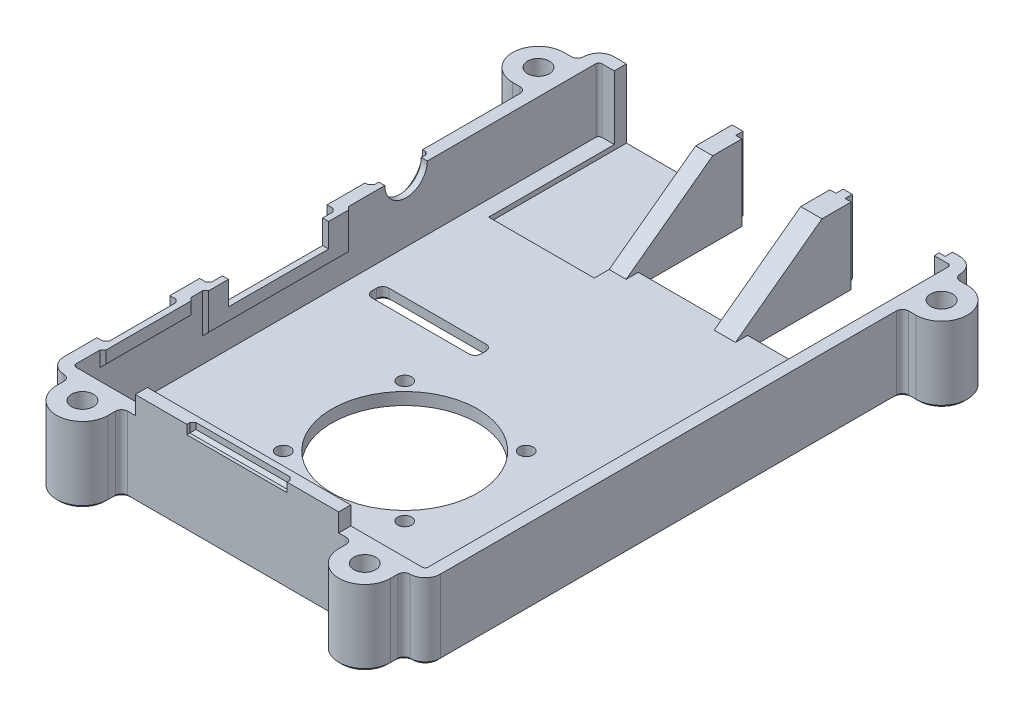
from build123d import *

# Parameters (mm, degrees)
BASE_DEPTH                      = 12.5
SHELL_T                         = -2
CLAMPS_DEPTH                    = 12.5
CLAMP_FILLETS_R                 = 1
SKETCH20_R                      = 1.8
CLAMP_HOLES_DEPTH               = 115.236651299
SKETCH21_R                      = 2.9
CLAMP_COUNTERSINKS_DEPTH        = 3.4
CLAMP_COUNTERSINK_CHAMFERS_SIZE = 0.3
SKETCH22_W                      = 33.5
SKETCH22_H                      = 2
SD_FILL_DEPTH                   = 3
SKETCH23_W                      = 16.5
SKETCH23_H                      = 1.5
SD_APPROACH_DEPTH               = 1
SD_APPROACH_CHAMFER_SIZE        = 0.5
SKETCH24_W                      = 14.5
SKETCH24_H                      = 12.5
USB_CUTOUT_DEPTH                = 18.25
SKETCH25_W                      = 16.5
SKETCH25_H                      = 12.5
USB_APPROACH_DEPTH              = 1.2
USB_INNER_SUPPORT_DEPTH         = 3.5
USB_OUTER_SUPPORT_DEPTH         = 2.8
SKETCH28_W                      = 17.4
SKETCH28_H                      = 11.3
RJ45_CUTOUT_DEPTH               = 22.7
SKETCH29_W                      = 15
SKETCH29_H                      = 2.5
SKETCH29_W_2                    = 24
SKETCH29_H_2                    = 6.43
HDMI_SUPPORT_DEPTH              = 0.5
HDMI_SUPPORT_CHAMFER_SIZE       = 0.5
SKETCH30_W                      = 21
SKETCH30_H                      = 5.93
SKETCH30_W_2                    = 12
SKETCH30_H_2                    = 2
HDMI_APPROACH_DEPTH             = 1.5
SKETCH31_W                      = 16.5
SKETCH31_H                      = 3.93
HDMI_CUTOUT_DEPTH               = 1
HDMI_APPROACH_CHAMFER_SIZE      = 0.5
SKETCH32_R                      = 3.5
AUDIO_CUTOUT_DEPTH              = 2
SKETCH33_R                      = 4.75
AUDIO_APPROACH_DEPTH            = 1
AUDIO_APPROACH_CHAMFER_SIZE     = 0.5
SKETCH34_W                      = 6
SKETCH34_H                      = 52.7
HEADER_CUTOUT_DEPTH             = 2
HEADER_COVER_DEPTH              = 1
SHELL_CHAMFER_SIZE              = 0.5
RIBBON_SLOTS_DEPTH              = 2
RIBBON_SLOT_CHAMFERS_SIZE       = 0.5
SKETCH38_R                      = 12
SKETCH38_R_2                    = 1.15
FAN_MOUNT_DEPTH                 = 2


with BuildPart() as part:
    # Sketch2 → Base (new body)
    with BuildSketch(Plane(origin=(0, 0, 0), x_dir=(1, 0, 0), z_dir=(0, 1, 0))):
        with BuildLine():
            Line((2.5, 0), (59.5, 0))
            ThreePointArc((59.5, 0), (61.267766953, 0.732233047), (62, 2.5))
            Line((62, 2.5), (62, 88.1))
            ThreePointArc((62, 88.1), (61.267766953, 89.867766953), (59.5, 90.6))
            Line((59.5, 90.6), (2.5, 90.6))
            ThreePointArc((2.5, 90.6), (0.732233047, 89.867766953), (0, 88.1))
            Line((0, 88.1), (0, 2.5))
            ThreePointArc((0, 2.5), (0.732233047, 0.732233047), (2.5, 0))
        make_face()
    extrude(amount=BASE_DEPTH)

    # Shell
    shell_openings = [part.faces().sort_by_distance(p)[0] for p in [
        (31, 12.5, -45.3),
    ]]
    offset(amount=SHELL_T, openings=shell_openings, kind=Kind.INTERSECTION)

    # Sketch14 → Clamps (add)
    with BuildSketch(Plane.XZ):
        with BuildLine():
            Line((-2.2, -78.6), (0, -78.6))
            Line((0, -78.6), (0, -87.1))
            Line((0, -87.1), (-2.2, -87.1))
            ThreePointArc((-2.2, -87.1), (-6.45, -82.85), (-2.2, -78.6))
        make_face()
        with BuildLine():
            Line((3.5, 2.2), (3.5, 0))
            Line((3.5, 0), (12, 0))
            Line((12, 0), (12, 2.2))
            ThreePointArc((12, 2.2), (7.75, 6.45), (3.5, 2.2))
        make_face()
        with BuildLine():
            Line((64.2, -78.6), (62, -78.6))
            Line((62, -78.6), (62, -87.1))
            Line((62, -87.1), (64.2, -87.1))
            ThreePointArc((64.2, -87.1), (68.45, -82.85), (64.2, -78.6))
        make_face()
        with BuildLine():
            Line((50, 0), (50, 2.2))
            ThreePointArc((50, 2.2), (54.25, 6.45), (58.5, 2.2))
            Line((58.5, 2.2), (58.5, 0))
            Line((58.5, 0), (50, 0))
        make_face()
    extrude(amount=-CLAMPS_DEPTH)

    # Clamp Fillets
    clamp_fillets_edges = [part.edges().sort_by_distance(p)[0] for p in [
        (0, 6.25, -87.1),
        (0, 6.25, -78.6),
        (3.5, 6.25, 0),
        (12, 6.25, 0),
        (62, 6.25, -78.6),
        (62, 6.25, -87.1),
        (50, 6.25, 0),
        (58.5, 6.25, 0),
    ]]
    fillet(clamp_fillets_edges, radius=CLAMP_FILLETS_R - 0.0001)  # a hair under: the kernel refuses the full size

    # Sketch20 → Clamp Holes (cut, through all)
    with BuildSketch(Plane.XZ):
        with Locations(Location((7.75, 2.2, 0), (0, 0, 270))):
            Circle(SKETCH20_R)
        with Locations(Location((54.25, 2.2, 0), (0, 0, 270))):
            Circle(SKETCH20_R)
        with Locations(Location((64.2, -82.85, 0), (0, 0, 270))):
            Circle(SKETCH20_R)
        with Locations(Location((-2.2, -82.85, 0), (0, 0, 270))):
            Circle(SKETCH20_R)
    extrude(amount=-CLAMP_HOLES_DEPTH, mode=Mode.SUBTRACT)

    # Sketch21 → Clamp Countersinks (cut)
    with BuildSketch(Plane.XZ):
        with Locations(Location((7.75, 2.2, 0), (0, 0, 270))):
            Circle(SKETCH21_R)
        with Locations(Location((54.25, 2.2, 0), (0, 0, 270))):
            Circle(SKETCH21_R)
        with Locations(Location((64.2, -82.85, 0), (0, 0, 270))):
            Circle(SKETCH21_R)
        with Locations(Location((-2.2, -82.85, 0), (0, 0, 270))):
            Circle(SKETCH21_R)
    extrude(amount=-CLAMP_COUNTERSINKS_DEPTH, mode=Mode.SUBTRACT)

    # Clamp Countersink Chamfers
    clamp_countersink_chamfers_edges = [part.edges().sort_by_distance(p)[0] for p in [
        (-2.2, 0, -79.95),
        (64.2, 0, -79.95),
        (54.25, 0, 5.1),
        (7.75, 0, 5.1),
    ]]
    chamfer(clamp_countersink_chamfers_edges, length=CLAMP_COUNTERSINK_CHAMFERS_SIZE)

    # Sketch22 → SD Fill (add)
    with BuildSketch(Plane(origin=(0, 12.5, 0), x_dir=(1, 0, 0), z_dir=(0, 1, 0))):
        with Locations((31, 1)):
            Rectangle(SKETCH22_W, SKETCH22_H)
    extrude(amount=SD_FILL_DEPTH)

    # Sketch23 → SD Approach (cut)
    with BuildSketch(Plane.XY):
        with Locations((31, 14.75)):
            Rectangle(SKETCH23_W, SKETCH23_H)
    extrude(amount=-SD_APPROACH_DEPTH, mode=Mode.SUBTRACT)

    # SD Approach Chamfer
    sd_approach_chamfer_edges = [part.edges().sort_by_distance(p)[0] for p in [
        (22.75, 14.75, -1),
        (39.25, 14.75, -1),
        (31, 14, -1),
    ]]
    chamfer(sd_approach_chamfer_edges, length=SD_APPROACH_CHAMFER_SIZE)

    # Sketch24 → USB Cutout (cut)
    with BuildSketch(Plane(origin=(0, 0, -90.6), x_dir=(-1, 0, 0), z_dir=(0, 0, -1))):
        with Locations((-50, 6.25)):
            Rectangle(SKETCH24_W, SKETCH24_H)
        with Locations((-32, 6.25)):
            Rectangle(SKETCH24_W, SKETCH24_H)
    extrude(amount=-USB_CUTOUT_DEPTH, mode=Mode.SUBTRACT)

    # Sketch25 → USB Approach (cut)
    with BuildSketch(Plane(origin=(0, 0, -90.6), x_dir=(-1, 0, 0), z_dir=(0, 0, -1))):
        with Locations((-50, 6.25)):
            Rectangle(SKETCH25_W, SKETCH25_H)
        with Locations((-32, 6.25)):
            Rectangle(SKETCH25_W, SKETCH25_H)
    extrude(amount=-USB_APPROACH_DEPTH, mode=Mode.SUBTRACT)

    # Sketch26 → USB Inner Support (add)
    with BuildSketch(Plane(origin=(42.75, 0, 0), x_dir=(0, 0, -1), z_dir=(1, 0, 0))):
        Polygon((88.6, 2), (88.6, 12.5), (84.6, 12.5), (70.35, 2), align=None)
    extrude(amount=-USB_INNER_SUPPORT_DEPTH)

    # Sketch27 → USB Outer Support (add)
    with BuildSketch(Plane(origin=(24.75, 0, 0), x_dir=(0, 0, -1), z_dir=(1, 0, 0))):
        Polygon((88.6, 2), (88.6, 12.5), (84.6, 12.5), (70.35, 2), align=None)
    extrude(amount=-USB_OUTER_SUPPORT_DEPTH)

    # Sketch28 → RJ45 Cutout (cut)
    with BuildSketch(Plane(origin=(0, 0, -90.6), x_dir=(-1, 0, 0), z_dir=(0, 0, -1))):
        with Locations((-13.25, 6.85)):
            Rectangle(SKETCH28_W, SKETCH28_H)
    extrude(amount=-RJ45_CUTOUT_DEPTH, mode=Mode.SUBTRACT)

    # Sketch29 → HDMI Support (add)
    with BuildSketch(Plane(origin=(2, 0, 0), x_dir=(0, 0, -1), z_dir=(1, 0, 0))):
        with Locations((13.95, 11.25)):
            Rectangle(SKETCH29_W, SKETCH29_H)
        with Locations((35.35, 9.285)):
            Rectangle(SKETCH29_W_2, SKETCH29_H_2)
    extrude(amount=HDMI_SUPPORT_DEPTH)

    # HDMI Support Chamfer
    hdmi_support_chamfer_edges = [part.edges().sort_by_distance(p)[0] for p in [
        (2.5, 9.285, -47.35),
        (2.5, 6.07, -35.35),
        (2.5, 9.285, -23.35),
        (2.5, 11.25, -21.45),
        (2.5, 10, -13.95),
        (2.5, 11.25, -6.45),
    ]]
    chamfer(hdmi_support_chamfer_edges, length=HDMI_SUPPORT_CHAMFER_SIZE - 0.0001)  # a hair under: the kernel refuses the full size

    # Sketch30 → HDMI Approach (cut)
    with BuildSketch(Plane.ZY):
        with Locations((-35.35, 9.535)):
            Rectangle(SKETCH30_W, SKETCH30_H)
        with Locations((-13.95, 11.5)):
            Rectangle(SKETCH30_W_2, SKETCH30_H_2)
    extrude(amount=-HDMI_APPROACH_DEPTH, mode=Mode.SUBTRACT)

    # Sketch31 → HDMI Cutout (cut)
    with BuildSketch(Plane.ZY.offset(-1.5)):
        with Locations((-35.35, 10.535)):
            Rectangle(SKETCH31_W, SKETCH31_H)
    extrude(amount=-HDMI_CUTOUT_DEPTH, mode=Mode.SUBTRACT)

    # HDMI Approach Chamfer
    hdmi_approach_chamfer_edges = [part.edges().sort_by_distance(p)[0] for p in [
        (1.5, 9.535, -24.85),
        (1.5, 6.57, -35.35),
        (1.5, 9.535, -45.85),
        (1.5, 11.5, -19.95),
        (1.5, 11.5, -7.95),
        (1.5, 10.5, -13.95),
    ]]
    chamfer(hdmi_approach_chamfer_edges, length=HDMI_APPROACH_CHAMFER_SIZE)

    # Sketch32 → Audio Cutout (cut)
    with BuildSketch(Plane.ZY):
        with Locations((-56.85, 12.5)):
            Circle(SKETCH32_R)
    extrude(amount=-AUDIO_CUTOUT_DEPTH, mode=Mode.SUBTRACT)

    # Sketch33 → Audio Approach (cut)
    with BuildSketch(Plane.ZY):
        with Locations((-56.85, 12.5)):
            Circle(SKETCH33_R)
    extrude(amount=-AUDIO_APPROACH_DEPTH, mode=Mode.SUBTRACT)

    # Audio Approach Chamfer
    audio_approach_chamfer_edges = [part.edges().sort_by_distance(p)[0] for p in [
        (1, 7.75, -56.85),
    ]]
    chamfer(audio_approach_chamfer_edges, length=AUDIO_APPROACH_CHAMFER_SIZE)

    # Sketch34 → Header Cutout (cut)
    with BuildSketch(Plane.XZ):
        with Locations((55.5, -35.75)):
            Rectangle(SKETCH34_W, SKETCH34_H)
    extrude(amount=-HEADER_CUTOUT_DEPTH, mode=Mode.SUBTRACT)

    # Sketch35 → Header Cover (add)
    with BuildSketch(Plane.XZ):
        Polygon((56, -9.4), (55, -9.4), (55, -10.4), (53.5, -10.4), (53.5, -15.3625), (52.5, -15.3625), (52.5, -16.3625), (53.5, -16.3625), (53.5, -28.2875), (52.5, -28.2875), (52.5, -29.2875), (53.5, -29.2875), (53.5, -34.25), (55, -34.25), (55, -35.25), (52.5, -35.25), (52.5, -36.25), (55, -36.25), (55, -37.25), (53.5, -37.25), (53.5, -42.2125), (52.5, -42.2125), (52.5, -43.2125), (53.5, -43.2125), (53.5, -55.1375), (52.5, -55.1375), (52.5, -56.1375), (53.5, -56.1375), (53.5, -61.1), (55, -61.1), (55, -62.1), (56, -62.1), (56, -61.1), (57.5, -61.1), (57.5, -56.1375), (58.5, -56.1375), (58.5, -55.1375), (57.5, -55.1375), (57.5, -43.2125), (58.5, -43.2125), (58.5, -42.2125), (57.5, -42.2125), (57.5, -37.25), (56, -37.25), (56, -36.25), (58.5, -36.25), (58.5, -35.25), (56, -35.25), (56, -34.25), (57.5, -34.25), (57.5, -29.2875), (58.5, -29.2875), (58.5, -28.2875), (57.5, -28.2875), (57.5, -16.3625), (58.5, -16.3625), (58.5, -15.3625), (57.5, -15.3625), (57.5, -10.4), (56, -10.4), align=None)
    extrude(amount=-HEADER_COVER_DEPTH)

    # Shell Chamfer
    shell_chamfer_edges = [part.edges().sort_by_distance(p)[0] for p in [
        (-1.59995, 0, -78.6),
        (63.59995, 0, -87.1),
        (49.707136071, 0, 0.292863929),
        (0.732233047, 0, -0.732233047),
        (58.792863929, 0, 0.292863929),
        (12.292863929, 0, 0.292863929),
        (3.207136071, 0, 0.292863929),
        (-0.292863929, 0, -87.392863929),
        (-0.292863929, 0, -78.307136071),
        (62.292863929, 0, -78.307136071),
        (62.292863929, 0, -87.392863929),
        (13.125, 0, -90.6),
        (41, 0, -90.6),
        (-6.45, 0, -82.85),
        (-1.59995, 0, -87.1),
        (7.75, 0, 6.45),
        (3.5, 0, 1.59995),
        (52.5, 0, -12.38125),
        (53.75, 0, -62.1),
        (58.5, 0, -59.11875),
        (57.25, 0, -9.4),
        (57.25, 0, -62.1),
        (58.5, 0, -49.175),
        (58.5, 0, -39.23125),
        (58.5, 0, -32.26875),
        (58.5, 0, -22.325),
        (58.5, 0, -12.38125),
        (53.75, 0, -9.4),
        (52.5, 0, -22.325),
        (52.5, 0, -32.26875),
        (52.5, 0, -39.23125),
        (52.5, 0, -49.175),
        (52.5, 0, -59.11875),
        (68.45, 0, -82.85),
        (63.59995, 0, -78.6),
        (54.25, 0, 6.45),
        (50, 0, 1.59995),
        (0.732233047, 0, -89.867766953),
        (58.875, 0, -90.6),
        (61.267766953, 0, -89.867766953),
        (31, 0, 0),
        (62, 0, -40.05005),
        (58.5, 0, 1.59995),
        (12, 0, 1.59995),
        (61.267766953, 0, -0.732233047),
        (0, 0, -40.05005),
    ]]
    chamfer(shell_chamfer_edges, length=SHELL_CHAMFER_SIZE)

    # Sketch36 → Ribbon Slots (cut)
    with BuildSketch(Plane.XZ):
        with BuildLine():
            Line((23.1, -5.7), (39.1, -5.7))
            ThreePointArc((39.1, -5.7), (39.807106781, -5.992893219), (40.1, -6.7))
            Line((40.1, -6.7), (40.1, -7.5))
            ThreePointArc((40.1, -7.5), (39.807106781, -8.207106781), (39.1, -8.5))
            Line((39.1, -8.5), (23.1, -8.5))
            ThreePointArc((23.1, -8.5), (22.392893219, -8.207106781), (22.1, -7.5))
            Line((22.1, -7.5), (22.1, -6.7))
            ThreePointArc((22.1, -6.7), (22.392893219, -5.992893219), (23.1, -5.7))
        make_face()
        with BuildLine():
            Line((6.45, -46.76), (22.45, -46.76))
            ThreePointArc((22.45, -46.76), (23.157106781, -47.052893219), (23.45, -47.76))
            Line((23.45, -47.76), (23.45, -48.56))
            ThreePointArc((23.45, -48.56), (23.157106781, -49.267106781), (22.45, -49.56))
            Line((22.45, -49.56), (6.45, -49.56))
            ThreePointArc((6.45, -49.56), (5.742893219, -49.267106781), (5.45, -48.56))
            Line((5.45, -48.56), (5.45, -47.76))
            ThreePointArc((5.45, -47.76), (5.742893219, -47.052893219), (6.45, -46.76))
        make_face()
    extrude(amount=-RIBBON_SLOTS_DEPTH, mode=Mode.SUBTRACT)

    # Ribbon Slot Chamfers
    ribbon_slot_chamfers_edges = [part.edges().sort_by_distance(p)[0] for p in [
        (22.392893219, 0, -8.207106781),
        (31.1, 0, -8.5),
        (39.807106781, 0, -8.207106781),
        (40.1, 0, -7.1),
        (39.807106781, 0, -5.992893219),
        (31.1, 0, -5.7),
        (22.392893219, 0, -5.992893219),
        (22.1, 0, -7.1),
        (5.742893219, 0, -49.267106781),
        (14.45, 0, -49.56),
        (23.157106781, 0, -49.267106781),
        (23.45, 0, -48.16),
        (23.157106781, 0, -47.052893219),
        (14.45, 0, -46.76),
        (5.742893219, 0, -47.052893219),
        (5.45, 0, -48.16),
    ]]
    chamfer(ribbon_slot_chamfers_edges, length=RIBBON_SLOT_CHAMFERS_SIZE)

    # Sketch38 → Fan Mount (cut)
    with BuildSketch(Plane.XZ):
        with Locations(Location((31, -27.63, 0), (0, 0, 270))):
            Circle(SKETCH38_R)
        with Locations(Location((40.99997481, -17.63002519, 0), (0, 0, 270))):
            Circle(SKETCH38_R_2)
        with Locations(Location((40.99997481, -37.62997481, 0), (0, 0, 270))):
            Circle(SKETCH38_R_2)
        with Locations(Location((21.00002519, -17.63002519, 0), (0, 0, 90))):
            Circle(SKETCH38_R_2)
        with Locations(Location((21.00002519, -37.62997481, 0), (0, 0, 90))):
            Circle(SKETCH38_R_2)
    extrude(amount=-FAN_MOUNT_DEPTH, mode=Mode.SUBTRACT)


solid = part.part
